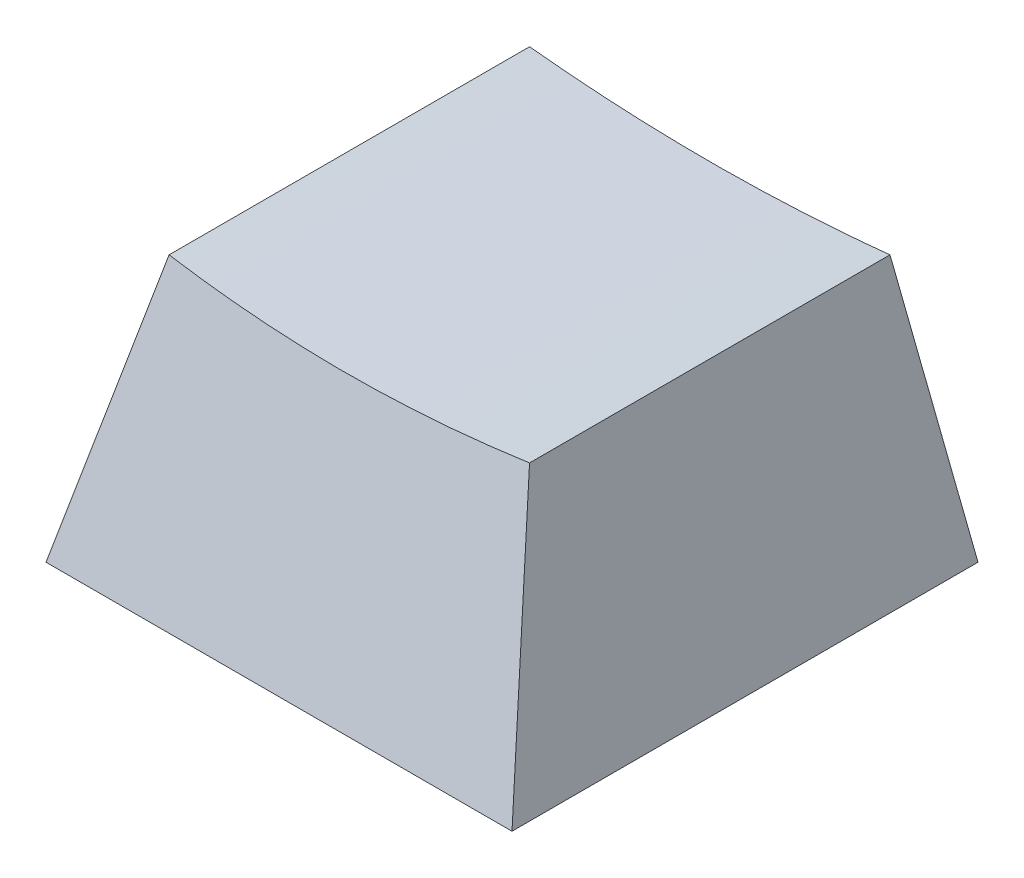
from build123d import *

# Parameters (mm, degrees)
SHELL1_T                = -2
SKETCH5_W               = 1.35
SKETCH5_H               = 12.225319986
SKETCH5_W_2             = 12.114403326
SKETCH5_H_2             = 1.35
BOSS_EXTRUDE1_DEPTH     = 4
CUT_EXTRUDE3_DEPTH      = 10
CUT_EXTRUDE3_DEPTH_BACK = 10
BOSS_EXTRUDE2_START     = -0.5
BOSS_EXTRUDE2_DEPTH     = 10
BOSS_EXTRUDE2_2_DEPTH   = 10
SKETCH8_W               = 8.738759906
SKETCH8_H               = 7.199411956
SKETCH8_W_2             = 6.5
SKETCH8_H_2             = 4.831184338
BOSS_EXTRUDE4_DEPTH     = 2
FILLET4_R               = 1


with BuildPart() as part:
    # Loft1: read off the stored shape, not the designer's step
    # Loft1: loft between two sections, ruled curve by curve
    loft1_from = [
        Edge.make_line((-9.05, 0, 9.05), (-9.05, 0, -9.05)),
        Edge.make_line((-9.05, 0, -9.05), (9.05, 0, -9.05)),
        Edge.make_line((9.05, 0, 9.05), (-9.05, 0, 9.05)),
        Edge.make_line((9.05, 0, -9.05), (9.05, 0, 9.05)),
    ]
    loft1_to = [
        Edge.make_line((-7, 10, 6.318777005), (-7, 10, -7.681222995)),
        Edge.make_line((-7, 10, -7.681222995), (7, 10, -7.681222995)),
        Edge.make_line((7, 10, 6.318777005), (-7, 10, 6.318777005)),
        Edge.make_line((7, 10, -7.681222995), (7, 10, 6.318777005)),
    ]
    loft1 = Solid(Shell([*[Face.make_surface_from_curves(loft1_from[k], loft1_to[k]) for k in range(4)], Face(Wire(loft1_from)), Face(Wire(loft1_to))]))
    add(loft1)

    # Shell1
    shell1_openings = [part.faces().sort_by_distance(p)[0] for p in [
        (0, 0, 0),
    ]]
    offset(amount=SHELL1_T, openings=shell1_openings, kind=Kind.INTERSECTION)

    # Sketch5 → Boss-Extrude1 (add)
    with BuildSketch(Plane(origin=(0, 10, 0), x_dir=(1, 0, 0), z_dir=(0, 1, 0))):
        with Locations((0, 0.862108036)):
            Rectangle(SKETCH5_W, SKETCH5_H)
        with Locations((0.109128691, 0.681416915)):
            Rectangle(SKETCH5_W_2, SKETCH5_H_2)
    extrude(amount=-BOSS_EXTRUDE1_DEPTH)

    # Sketch4 → Cut-Extrude3 (cut, two sides: drawn at the far end of the back side and taken through both)
    with BuildSketch(Plane.XY.offset(-CUT_EXTRUDE3_DEPTH_BACK)):
        with BuildLine():
            Line((-7, 10), (7, 10))
            add(Edge.make_bspline(
                [(-7, 10), (-2.602300298, 9.460265696), (1.993912061, 9.41154423), (7, 10)],
                knots=[0, 0, 0, 0, 1, 1, 1, 1], degree=3))
        make_face()
    extrude(amount=CUT_EXTRUDE3_DEPTH + CUT_EXTRUDE3_DEPTH_BACK, mode=Mode.SUBTRACT)



with BuildPart() as body_2:
    # Sketch6 → Boss-Extrude2 (new body)
    with BuildSketch(Plane(origin=(0, 10, 0), x_dir=(1, 0, 0), z_dir=(0, 1, 0)).offset(BOSS_EXTRUDE2_START)):
        with BuildLine():
            Line((0.675, -0.005353557), (0.675, -1.75))
            Line((0.675, -1.75), (3.25, -1.75))
            Line((3.25, -1.75), (3.25, 3.09053704))
            Line((3.25, 3.09053704), (0.675, 3.09053704))
            Line((0.675, 3.09053704), (0.675, 1.494646443))
            Line((0.675, 1.494646443), (2.90473751, 1.494646443))
            ThreePointArc((2.90473751, 1.494646443), (3.109676589, 0.744646443), (2.90473751, -0.005353557))
            Line((2.90473751, -0.005353557), (0.675, -0.005353557))
        make_face()
    extrude(amount=-BOSS_EXTRUDE2_DEPTH)


with BuildPart() as body_3:
    # Sketch6 → Boss-Extrude2 2 (new body)
    with BuildSketch(Plane(origin=(0, 10, 0), x_dir=(1, 0, 0), z_dir=(0, 1, 0)).offset(BOSS_EXTRUDE2_START)):
        with BuildLine():
            Line((-0.675, -1.75), (-0.675, -0.005353557))
            Line((-0.675, -0.005353557), (-2.90473751, -0.005353557))
            ThreePointArc((-2.90473751, -0.005353557), (-3.109676589, 0.744646443), (-2.90473751, 1.494646443))
            Line((-2.90473751, 1.494646443), (-0.675, 1.494646443))
            Line((-0.675, 1.494646443), (-0.675, 3.09053704))
            Line((-0.675, 3.09053704), (-3.25, 3.09053704))
            Line((-3.25, 3.09053704), (-3.25, -1.75))
            Line((-3.25, -1.75), (-0.675, -1.75))
        make_face()
    extrude(amount=-BOSS_EXTRUDE2_2_DEPTH)


with BuildPart() as part_1:
    add(part.part)

    add(body_2.part)  # Boss-Extrude4 merges body 2

    add(body_3.part)  # Boss-Extrude4 merges body 3
    # Sketch8 → Boss-Extrude4 (add)
    with BuildSketch(Plane(origin=(0, 8, -8), x_dir=(1, 0, 0), z_dir=(0, -1, 0))):
        with Locations((0, 7.325055129)):
            Rectangle(SKETCH8_W, SKETCH8_H)
        with Locations((0, 7.325055129)):
            Rectangle(SKETCH8_W_2, SKETCH8_H_2, mode=Mode.SUBTRACT)
    extrude(amount=BOSS_EXTRUDE4_DEPTH)

    # Fillet4
    fillet4_edges = [part_1.edges().sort_by_distance(p)[0] for p in [
        (3.25, 6, -0.67026852),
        (-3.25, 6, -0.67026852),
        (-1.9625, 6, -3.09053704),
        (1.9625, 6, -3.09053704),
        (1.9625, 6, 1.75),
        (-1.9625, 6, 1.75),
    ]]
    fillet(fillet4_edges, radius=FILLET4_R)


solid = part_1.part
